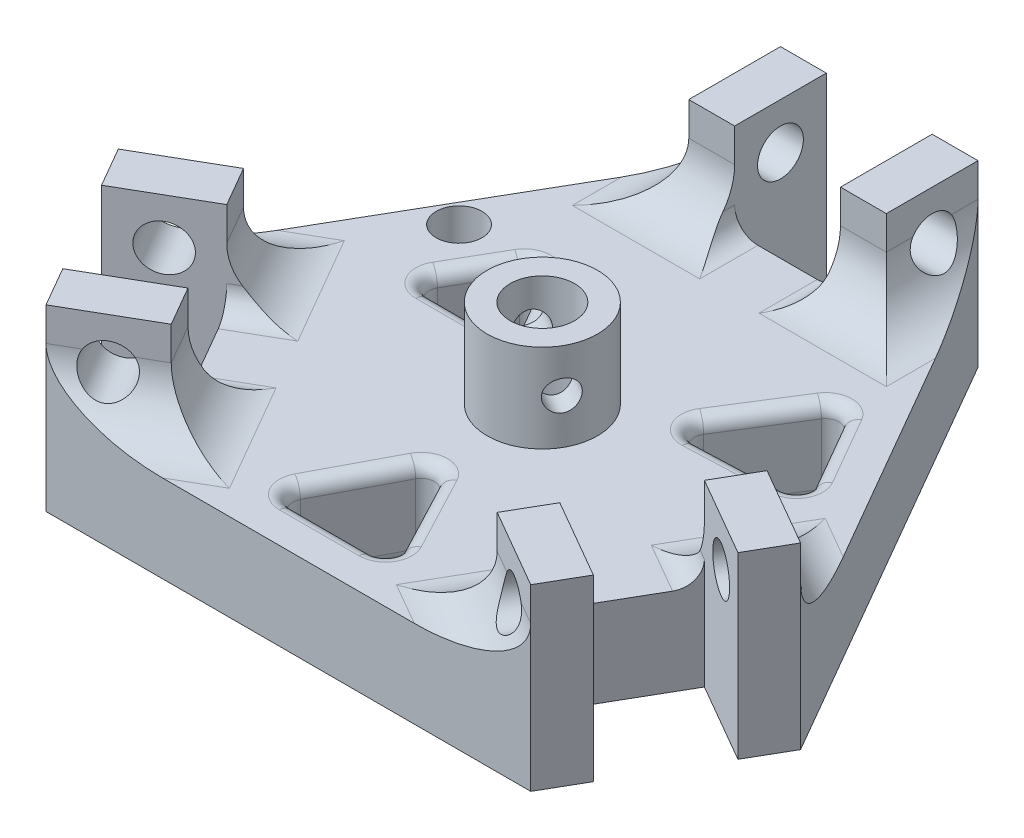
from build123d import *
from OCP.BRepAlgoAPI import BRepAlgoAPI_Cut
from OCP.TopTools import TopTools_ListOfShape

# Parameters (mm, degrees)
BOSS_EXTRUDE1_DEPTH = 19.05
SKETCH2_W           = 10
SKETCH2_H           = 20.000000000000014
SKETCH2_H_2         = 20
BOSS_EXTRUDE2_DEPTH = 20
SKETCH3_R           = 5.0000000000000036
CUT_EXTRUDE1_DEPTH  = 139.28036113669583
SKETCH4_R           = 4.999999999999997
CUT_EXTRUDE2_DEPTH  = 123.5366696211343
SKETCH5_R           = 4.999999999999997
CUT_EXTRUDE3_DEPTH  = 130.8302360256937
CUT_EXTRUDE4_DEPTH  = 120.68795542763824
FILLET1_R           = 12.7
FILLET2_R           = 5.079999999999999
SCALE1_SCALE        = 0.66
SKETCH7_R           = 4.6354999999999995
CUT_EXTRUDE5_DEPTH  = 84.79283151601535
BOSS_EXTRUDE3_START = 12.700000000000001
SKETCH8_R           = 7.949670541950213
SKETCH8_R_2         = 4.635500000000001
BOSS_EXTRUDE3_DEPTH = 12.700000000000001
SKETCH9_R           = 2.1590000000000047
CUT_EXTRUDE6_DEPTH  = 112.34018394089706
SKETCH10_R          = 3.301999999999999
CUT_EXTRUDE8_DEPTH  = 84.79283151601535
CUT_EXTRUDE9_DEPTH  = 84.79283151601535
FILLET3_R           = 1.9049999999999998


with BuildPart() as part:
    # Sketch1 → Boss-Extrude1 (new body)
    with BuildSketch(Plane(origin=(0, 0, 0), x_dir=(1, 0, 0), z_dir=(0, 1, 0))):
        Polygon((-74.42044969854275, 3.47e-15), (-52.87344431475024, -37.320508075688764), (52.87344431475023, -37.320508075688764), (74.42044969854274, 1.995e-14), (21.547005383792506, 91.57949192431124), (-21.547005383792513, 91.57949192431123), align=None)
    extrude(amount=BOSS_EXTRUDE1_DEPTH)

    # Sketch2 → Boss-Extrude2 (add)
    with BuildSketch(Plane(origin=(0, 19.05, 0), x_dir=(1, 0, 0), z_dir=(0, 1, 0))):
        Polygon((52.09994162285397, 1.3397459621556316), (57.09994162285396, 10.00000000000002), (74.42044969854274, 1.995e-14), (69.42044969854274, -8.660254037844359), align=None)
        with Locations((16.547005383792506, 81.57949192431124)):
            Rectangle(SKETCH2_W, SKETCH2_H)
        with Locations((-16.547005383792513, 81.57949192431123)):
            Rectangle(SKETCH2_W, SKETCH2_H_2)
        Polygon((52.87344431475023, -37.320508075688764), (35.55293623906147, -27.320508075688775), (40.55293623906146, -18.660254037844382), (57.87344431475022, -28.66025403784437), align=None)
        Polygon((-52.87344431475024, -37.320508075688764), (-57.87344431475025, -28.660254037844382), (-40.552936239061474, -18.660254037844382), (-35.55293623906148, -27.32050807568877), align=None)
        Polygon((-69.42044969854274, -8.660254037844384), (-74.42044969854275, 3.47e-15), (-57.099941622853976, 9.999999999999998), (-52.09994162285398, 1.3397459621556103), align=None)
    extrude(amount=BOSS_EXTRUDE2_DEPTH)

    # Sketch3 → Cut-Extrude1 (cut, through all)
    with BuildSketch(Plane.ZY.offset(21.547005383792513)):
        with Locations((-81.57949192431123, 29.05)):
            Circle(SKETCH3_R)
    extrude(amount=-CUT_EXTRUDE1_DEPTH, mode=Mode.SUBTRACT)

    # Sketch4 → Cut-Extrude2 (cut, through all)
    with BuildSketch(Plane(origin=(-18.60511242463568, 0, -32.224999999999994), x_dir=(-0.8660254037844386, 0, 0.5000000000000002), z_dir=(-0.5000000000000001, 0, -0.8660254037844385))):
        with Locations((54.449999999999996, 29.05)):
            Circle(SKETCH4_R)
    extrude(amount=-CUT_EXTRUDE2_DEPTH, mode=Mode.SUBTRACT)

    # Sketch5 → Cut-Extrude3 (cut, through all)
    with BuildSketch(Plane(origin=(-2.941892959156835, 0, 5.095508075688795), x_dir=(0.8660254037844387, 0, 0.49999999999999983), z_dir=(-0.49999999999999983, 0, 0.8660254037844387))):
        with Locations((54.44999999999999, 29.05)):
            Circle(SKETCH5_R)
    extrude(amount=-CUT_EXTRUDE3_DEPTH, mode=Mode.SUBTRACT)

    # Sketch6 → Cut-Extrude4 (cut, through all)
    with BuildSketch(Plane(origin=(0, 19.05, 0), x_dir=(1, 0, 0), z_dir=(0, 1, 0))):
        Polygon((-69.42044969854274, -8.660254037844384), (-52.09994162285399, 1.339745962155612), (-40.552936239061474, -18.660254037844382), (-57.87344431475025, -28.660254037844354), align=None)
        Polygon((-11.547005383792513, 71.57949192431123), (11.547005383792506, 71.57949192431123), (11.547005383792506, 91.57949192431124), (-11.547005383792513, 91.57949192431123), align=None)
        Polygon((52.09994162285396, 1.3397459621556327), (69.42044969854274, -8.660254037844359), (57.87344431475022, -28.66025403784437), (40.55293623906146, -18.660254037844382), align=None)
    extrude(amount=-CUT_EXTRUDE4_DEPTH, mode=Mode.SUBTRACT)

    # Fillet1
    # the kernel refuses this fillet: 12.7 mm, written as the material it adds along each edge
    with BuildSketch(Plane(origin=(21.547005383792506, 19.05, -123.32949192431124), x_dir=(1, -2.8e-16, 0), z_dir=(0, 0, 1))) as fillet1_piece_1_section:
        with BuildLine():
            CenterArc((FILLET1_R, FILLET1_R), FILLET1_R, 180, 90)
            Line((-7.11e-15, FILLET1_R), (0, 0))
            Line((0, 0), (FILLET1_R, 0))
        make_face()
    fillet1_piece_1 = extrude(amount=51.750000000000014, mode=Mode.PRIVATE)
    fillet1_piece_1 = split(fillet1_piece_1, bisect_by=Plane(origin=(7.7988520987145495, 19.05, -115.39199192431126), z_dir=(-0.8660254037844388, 0, 0.4999999999999999)), keep=Keep.TOP, mode=Mode.PRIVATE)
    fillet1_piece_1 = fillet1_piece_1 - Plane(origin=(21.547005383792506, 29.05, -81.57949192431123), x_dir=(0, 0, 1), z_dir=(-1, 0, 0)) * Cylinder(5.0000000000000036, 155, mode=Mode.PRIVATE)
    add(fillet1_piece_1)
    with BuildSketch(Plane(origin=(21.547005383792506, 19.05, -71.57949192431123), x_dir=(0, -2.8e-16, 1), z_dir=(-1, 0, 0)), Plane(origin=(-11.547005383792513, 19.05, -71.57949192431123), x_dir=(0, -2.8e-16, 1), z_dir=(-1, 0, 0))) as fillet1_piece_2:
        with BuildLine():
            CenterArc((FILLET1_R, FILLET1_R), FILLET1_R, 180, 90)
            Line((-3.55e-15, FILLET1_R), (0, 0))
            Line((0, 0), (FILLET1_R, 0))
        make_face()
    extrude(amount=10)
    with BuildSketch(Plane(origin=(53.29700538379251, 19.05, -71.57949192431123), x_dir=(0, -2.8e-16, 1), z_dir=(-1, 0, 0))) as fillet1_piece_3_section:
        with BuildLine():
            CenterArc((FILLET1_R, FILLET1_R), FILLET1_R, 180, 90)
            Line((-3.55e-15, FILLET1_R), (0, 0))
            Line((0, 0), (FILLET1_R, 0))
        make_face()
    fillet1_piece_3 = extrude(amount=73.50000000000001, mode=Mode.PRIVATE)
    fillet1_piece_3 = split(fillet1_piece_3, bisect_by=Plane(origin=(-11.54700538379251, 19.05, -71.57949192431123), z_dir=(-1, 0, 0)), keep=Keep.TOP, mode=Mode.PRIVATE)
    add(fillet1_piece_3)
    with BuildSketch(Plane(origin=(-21.547005383792513, 19.05, -71.57949192431123), x_dir=(-1, -2.8e-16, 0), z_dir=(0, 0, -1))) as fillet1_piece_4_section:
        with BuildLine():
            CenterArc((FILLET1_R, FILLET1_R), FILLET1_R, 180, 90)
            Line((-7.11e-15, FILLET1_R), (0, 0))
            Line((0, 0), (FILLET1_R, 0))
        make_face()
    fillet1_piece_4 = extrude(amount=51.75, mode=Mode.PRIVATE)
    fillet1_piece_4 = fillet1_piece_4 - Plane(origin=(-21.547005383792513, 29.05, -81.57949192431123), x_dir=(0, 0, 1), z_dir=(-1, 0, 0)) * Cylinder(5.0000000000000036, 155, mode=Mode.PRIVATE)
    fillet1_piece_4 = split(fillet1_piece_4, bisect_by=Plane(origin=(-30.207259421636905, 19.05, -76.57949192431123), z_dir=(0.8660254037844387, 0, 0.5)), keep=Keep.TOP, mode=Mode.PRIVATE)
    add(fillet1_piece_4)
    with BuildSketch(Plane(origin=(20.202994616207494, 19.05, -71.57949192431123), x_dir=(0, -2.8e-16, 1), z_dir=(-1, 0, 0))) as fillet1_piece_5_section:
        with BuildLine():
            CenterArc((FILLET1_R, FILLET1_R), FILLET1_R, 180, 90)
            Line((-3.55e-15, FILLET1_R), (0, 0))
            Line((0, 0), (FILLET1_R, 0))
        make_face()
    fillet1_piece_5 = extrude(amount=73.50000000000001, mode=Mode.PRIVATE)
    fillet1_piece_5 = split(fillet1_piece_5, bisect_by=Plane(origin=(11.547005383792506, 19.05, -71.57949192431123), z_dir=(1, 0, 0)), keep=Keep.TOP, mode=Mode.PRIVATE)
    add(fillet1_piece_5)
    with BuildSketch(Plane(origin=(57.09994162285396, 19.05, -10.00000000000002), x_dir=(0.49999999999999983, 0, -0.8660254037844387), z_dir=(0.8660254037844387, 0, 0.4999999999999999))) as fillet1_piece_6_section:
        with BuildLine():
            CenterArc((FILLET1_R, FILLET1_R), FILLET1_R, 180, 90)
            Line((-5.09e-15, FILLET1_R), (0, 0))
            Line((0, 0), (FILLET1_R, 0))
        make_face()
    fillet1_piece_6 = extrude(amount=51.75, mode=Mode.PRIVATE)
    fillet1_piece_6 = fillet1_piece_6 - Plane(origin=(65.76019566069837, 29.05, -5.000000000000012), x_dir=(0.8660254037844387, 0, 0.49999999999999983), z_dir=(-0.49999999999999983, 0, 0.8660254037844387)) * Cylinder(4.999999999999997, 155, mode=Mode.PRIVATE)
    fillet1_piece_6 = split(fillet1_piece_6, bisect_by=Plane(origin=(65.76019566069836, 19.05, -15.000000000000023), z_dir=(-0.8660254037844388, 0, 0.4999999999999999)), keep=Keep.TOP, mode=Mode.PRIVATE)
    add(fillet1_piece_6)
    with BuildSketch(Plane(origin=(36.22494162285399, 19.05, 26.156560608000298), x_dir=(-0.866025403784439, 0, -0.49999999999999944), z_dir=(0.49999999999999944, 0, -0.866025403784439))) as fillet1_piece_7_section:
        with BuildLine():
            CenterArc((FILLET1_R, FILLET1_R), FILLET1_R, 180, 90)
            Line((-3.55e-15, FILLET1_R), (0, 0))
            Line((0, 0), (FILLET1_R, 0))
        make_face()
    fillet1_piece_7 = extrude(amount=73.49999999999997, mode=Mode.PRIVATE)
    fillet1_piece_7 = split(fillet1_piece_7, bisect_by=Plane(origin=(40.55293623906147, 19.05, 18.660254037844382), z_dir=(-0.49999999999999983, 0, 0.8660254037844388)), keep=Keep.TOP, mode=Mode.PRIVATE)
    add(fillet1_piece_7)
    with BuildSketch(Plane(origin=(52.09994162285397, 19.05, -1.3397459621556314), x_dir=(-0.866025403784439, 0, -0.49999999999999944), z_dir=(0.49999999999999944, 0, -0.866025403784439))) as fillet1_piece_8:
        with BuildLine():
            CenterArc((FILLET1_R, FILLET1_R), FILLET1_R, 180, 90)
            Line((-4.44e-15, FILLET1_R), (0, 0))
            Line((0, 0), (FILLET1_R, 0))
        make_face()
    extrude(amount=9.999999999999998)
    with BuildSketch(Plane(origin=(35.55293623906147, 19.05, 27.320508075688775), x_dir=(-0.8660254037844392, 0, -0.4999999999999992), z_dir=(0.4999999999999992, 0, -0.8660254037844392))) as fillet1_piece_9:
        with BuildLine():
            CenterArc((FILLET1_R, FILLET1_R), FILLET1_R, 180, 90)
            Line((-1.78e-15, FILLET1_R), (0, 0))
            Line((0, 0), (FILLET1_R, 0))
        make_face()
    extrude(amount=10.000000000000002)
    with BuildSketch(Plane(origin=(19.677936239061488, 19.05, 54.81681464584472), x_dir=(-0.8660254037844392, 0, -0.4999999999999992), z_dir=(0.4999999999999992, 0, -0.8660254037844392))) as fillet1_piece_10_section:
        with BuildLine():
            CenterArc((FILLET1_R, FILLET1_R), FILLET1_R, 180, 90)
            Line((0, FILLET1_R), (0, 0))
            Line((0, 0), (FILLET1_R, 0))
        make_face()
    fillet1_piece_10 = extrude(amount=73.50000000000003, mode=Mode.PRIVATE)
    fillet1_piece_10 = split(fillet1_piece_10, bisect_by=Plane(origin=(52.09994162285398, 19.05, -1.3397459621556251), z_dir=(0.49999999999999956, 0, -0.8660254037844389)), keep=Keep.TOP, mode=Mode.PRIVATE)
    add(fillet1_piece_10)
    with BuildSketch(Plane(origin=(80.36975088490617, 19.05, 53.195508075688764), x_dir=(-0.4999999999999998, 0, 0.8660254037844387), z_dir=(-0.8660254037844388, 0, -0.49999999999999983))) as fillet1_piece_11_section:
        with BuildLine():
            CenterArc((FILLET1_R, FILLET1_R), FILLET1_R, 180, 90)
            Line((-2.6e-15, FILLET1_R), (0, 0))
            Line((0, 0), (FILLET1_R, 0))
        make_face()
    fillet1_piece_11 = extrude(amount=51.75, mode=Mode.PRIVATE)
    fillet1_piece_11 = split(fillet1_piece_11, bisect_by=Plane(origin=(80.36975088490617, 19.05, 37.320508075688764), z_dir=(0, 0, -1)), keep=Keep.TOP, mode=Mode.PRIVATE)
    fillet1_piece_11 = fillet1_piece_11 - Plane(origin=(44.213190276905856, 29.05, 32.32050807568877), x_dir=(0.8660254037844387, 0, 0.49999999999999983), z_dir=(-0.49999999999999983, 0, 0.8660254037844387)) * Cylinder(4.999999999999997, 155, mode=Mode.PRIVATE)
    add(fillet1_piece_11)
    with BuildSketch(Plane(origin=(-35.55293623906148, 19.05, 27.32050807568877), x_dir=(0.5000000000000001, 0, 0.8660254037844386), z_dir=(-0.8660254037844386, 0, 0.5000000000000001))) as fillet1_piece_12_section:
        with BuildLine():
            CenterArc((FILLET1_R, FILLET1_R), FILLET1_R, 180, 90)
            Line((-7.11e-15, FILLET1_R), (0, 0))
            Line((0, 0), (FILLET1_R, 0))
        make_face()
    fillet1_piece_12 = extrude(amount=51.74999999999997, mode=Mode.PRIVATE)
    fillet1_piece_12 = fillet1_piece_12 - Plane(origin=(-44.21319027690585, 29.05, 32.320508075688764), x_dir=(-0.8660254037844386, 0, 0.5000000000000002), z_dir=(-0.5000000000000002, 0, -0.8660254037844386)) * Cylinder(4.999999999999997, 155, mode=Mode.PRIVATE)
    fillet1_piece_12 = split(fillet1_piece_12, bisect_by=Plane(origin=(-35.55293623906148, 19.05, 37.320508075688764), z_dir=(0, 0, -1)), keep=Keep.TOP, mode=Mode.PRIVATE)
    add(fillet1_piece_12)
    with BuildSketch(Plane(origin=(-56.42793623906145, 19.05, -8.836052532311559), x_dir=(0.866025403784439, 0, -0.4999999999999993), z_dir=(0.4999999999999994, 0, 0.866025403784439))) as fillet1_piece_13_section:
        with BuildLine():
            CenterArc((FILLET1_R, FILLET1_R), FILLET1_R, 180, 90)
            Line((-5.33e-15, FILLET1_R), (0, 0))
            Line((0, 0), (FILLET1_R, 0))
        make_face()
    fillet1_piece_13 = extrude(amount=73.50000000000001, mode=Mode.PRIVATE)
    fillet1_piece_13 = split(fillet1_piece_13, bisect_by=Plane(origin=(-52.09994162285396, 19.05, -1.3397459621556305), z_dir=(-0.5000000000000004, 0, -0.8660254037844385)), keep=Keep.TOP, mode=Mode.PRIVATE)
    add(fillet1_piece_13)
    with BuildSketch(Plane(origin=(-40.552936239061474, 19.05, 18.660254037844382), x_dir=(0.866025403784439, 0, -0.4999999999999993), z_dir=(0.4999999999999994, 0, 0.866025403784439))) as fillet1_piece_14:
        with BuildLine():
            CenterArc((FILLET1_R, FILLET1_R), FILLET1_R, 180, 90)
            Line((-5.33e-15, FILLET1_R), (0, 0))
            Line((0, 0), (FILLET1_R, 0))
        make_face()
    extrude(amount=9.999999999999998)
    with BuildSketch(Plane(origin=(-57.099941622853976, 19.05, -9.999999999999998), x_dir=(-6e-17, 1, 3e-17), z_dir=(0.49999999999999944, 0, 0.866025403784439))) as fillet1_piece_15:
        with BuildLine():
            CenterArc((FILLET1_R, -FILLET1_R), FILLET1_R, 90, 90)
            Line((-4.44e-15, -FILLET1_R), (0, 0))
            Line((0, 0), (FILLET1_R, 0))
        make_face()
    extrude(amount=9.999999999999998)
    with BuildSketch(Plane(origin=(-72.97494162285396, 19.05, -37.49630657015594), x_dir=(0, 1, 0), z_dir=(0.49999999999999944, 0, 0.866025403784439))) as fillet1_piece_16_section:
        with BuildLine():
            CenterArc((FILLET1_R, -FILLET1_R), FILLET1_R, 90, 90)
            Line((-3.55e-15, -FILLET1_R), (0, 0))
            Line((0, 0), (FILLET1_R, 0))
        make_face()
    fillet1_piece_16 = extrude(amount=73.5, mode=Mode.PRIVATE)
    fillet1_piece_16 = split(fillet1_piece_16, bisect_by=Plane(origin=(-40.55293623906153, 19.05, 18.66025403784441), z_dir=(0.49999999999999883, 0, 0.8660254037844394)), keep=Keep.TOP, mode=Mode.PRIVATE)
    add(fillet1_piece_16)
    with BuildSketch(Plane(origin=(-101.91675626869869, 19.05, 15.87499999999999), x_dir=(-0.4999999999999997, 0, -0.8660254037844389), z_dir=(0.8660254037844389, 0, -0.4999999999999997))) as fillet1_piece_17_section:
        with BuildLine():
            CenterArc((FILLET1_R, FILLET1_R), FILLET1_R, 180, 90)
            Line((-3.55e-15, FILLET1_R), (0, 0))
            Line((0, 0), (FILLET1_R, 0))
        make_face()
    fillet1_piece_17 = extrude(amount=51.750000000000014, mode=Mode.PRIVATE)
    fillet1_piece_17 = fillet1_piece_17 - Plane(origin=(-65.76019566069837, 29.05, -5.000000000000021), x_dir=(-0.8660254037844386, 0, 0.5000000000000002), z_dir=(-0.5000000000000002, 0, -0.8660254037844386)) * Cylinder(4.999999999999997, 155, mode=Mode.PRIVATE)
    fillet1_piece_17 = split(fillet1_piece_17, bisect_by=Plane(origin=(-88.16860298362072, 19.05, 23.812499999999996), z_dir=(0.8660254037844387, 0, 0.5)), keep=Keep.TOP, mode=Mode.PRIVATE)
    add(fillet1_piece_17)
    with BuildSketch(Plane(origin=(53.29700538379251, 19.05, -71.57949192431123), x_dir=(0, -2.8e-16, 1), z_dir=(-1, 0, 0))) as fillet1_piece_18a_section:
        with BuildLine():
            CenterArc((FILLET1_R, FILLET1_R), FILLET1_R, 180, 90)
            Line((-3.55e-15, FILLET1_R), (0, 0))
            Line((0, 0), (FILLET1_R, 0))
        make_face()
    fillet1_piece_18a = extrude(amount=41.75, mode=Mode.PRIVATE)
    fillet1_piece_18a = split(fillet1_piece_18a, bisect_by=Plane(origin=(38.14475942163689, 19.05, -62.831338639233266), z_dir=(-0.8660254037844388, 0, 0.4999999999999999)), keep=Keep.TOP, mode=Mode.PRIVATE)
    fillet1_piece_18a = split(fillet1_piece_18a, bisect_by=Plane(origin=(21.547005383792506, 19.05, -71.57949192431123), z_dir=(1, 0, 0)), keep=Keep.TOP, mode=Mode.PRIVATE)
    with BuildSketch(Plane(origin=(21.547005383792506, 19.05, -91.57949192431124), x_dir=(1, -2.8e-16, 0), z_dir=(0, 0, 1))) as fillet1_piece_18b_section:
        with BuildLine():
            CenterArc((FILLET1_R, FILLET1_R), FILLET1_R, 180, 90)
            Line((-7.11e-15, FILLET1_R), (0, 0))
            Line((0, 0), (FILLET1_R, 0))
        make_face()
    fillet1_piece_18b = extrude(amount=51.75000000000001, mode=Mode.PRIVATE)
    fillet1_piece_18b = split(fillet1_piece_18b, bisect_by=Plane(origin=(21.547005383792506, 19.05, -71.57949192431123), z_dir=(0, 0, 1)), keep=Keep.TOP, mode=Mode.PRIVATE)
    fillet1_piece_18 = fillet1_piece_18a & fillet1_piece_18b
    add(fillet1_piece_18)
    with BuildSketch(Plane(origin=(-21.547005383792513, 19.05, -39.82949192431123), x_dir=(-1, -2.8e-16, 0), z_dir=(0, 0, -1))) as fillet1_piece_19a_section:
        with BuildLine():
            CenterArc((FILLET1_R, FILLET1_R), FILLET1_R, 180, 90)
            Line((-7.11e-15, FILLET1_R), (0, 0))
            Line((0, 0), (FILLET1_R, 0))
        make_face()
    fillet1_piece_19a = extrude(amount=51.75, mode=Mode.PRIVATE)
    fillet1_piece_19a = split(fillet1_piece_19a, bisect_by=Plane(origin=(-21.547005383792513, 19.05, -71.57949192431123), z_dir=(0, 0, 1)), keep=Keep.TOP, mode=Mode.PRIVATE)
    with BuildSketch(Plane(origin=(-11.547005383792513, 19.05, -71.57949192431123), x_dir=(0, -2.8e-16, 1), z_dir=(-1, 0, 0))) as fillet1_piece_19b_section:
        with BuildLine():
            CenterArc((FILLET1_R, FILLET1_R), FILLET1_R, 180, 90)
            Line((-3.55e-15, FILLET1_R), (0, 0))
            Line((0, 0), (FILLET1_R, 0))
        make_face()
    fillet1_piece_19b = extrude(amount=41.750000000000014, mode=Mode.PRIVATE)
    fillet1_piece_19b = split(fillet1_piece_19b, bisect_by=Plane(origin=(-21.547005383792513, 19.05, -71.57949192431123), z_dir=(-1, 0, 0)), keep=Keep.TOP, mode=Mode.PRIVATE)
    fillet1_piece_19b = split(fillet1_piece_19b, bisect_by=Plane(origin=(-27.7072594216369, 19.05, -80.90961894323343), z_dir=(0.8660254037844387, 0, 0.5)), keep=Keep.TOP, mode=Mode.PRIVATE)
    fillet1_piece_19 = fillet1_piece_19a & fillet1_piece_19b
    add(fillet1_piece_19)
    with BuildSketch(Plane(origin=(29.603635052698024, 19.05, -25.87500000000002), x_dir=(0.4999999999999998, 0, -0.8660254037844387), z_dir=(0.8660254037844387, 0, 0.4999999999999999))) as fillet1_piece_20a_section:
        with BuildLine():
            CenterArc((FILLET1_R, FILLET1_R), FILLET1_R, 180, 90)
            Line((-6.63e-15, FILLET1_R), (0, 0))
            Line((0, 0), (FILLET1_R, 0))
        make_face()
    fillet1_piece_20a = extrude(amount=51.750000000000014, mode=Mode.PRIVATE)
    fillet1_piece_20a = split(fillet1_piece_20a, bisect_by=Plane(origin=(57.099941622853976, 19.05, -10.000000000000032), z_dir=(-0.866025403784439, 0, -0.49999999999999944)), keep=Keep.TOP, mode=Mode.PRIVATE)
    with BuildSketch(Plane(origin=(52.09994162285397, 19.05, -1.3397459621556314), x_dir=(-0.866025403784439, 0, -0.49999999999999944), z_dir=(0.49999999999999944, 0, -0.866025403784439))) as fillet1_piece_20b_section:
        with BuildLine():
            CenterArc((FILLET1_R, FILLET1_R), FILLET1_R, 180, 90)
            Line((-4.44e-15, FILLET1_R), (0, 0))
            Line((0, 0), (FILLET1_R, 0))
        make_face()
    fillet1_piece_20b = extrude(amount=41.749999999999986, mode=Mode.PRIVATE)
    fillet1_piece_20b = split(fillet1_piece_20b, bisect_by=Plane(origin=(57.09994162285397, 19.05, -10.000000000000018), z_dir=(0.4999999999999999, 0, -0.8660254037844387)), keep=Keep.TOP, mode=Mode.PRIVATE)
    fillet1_piece_20b = split(fillet1_piece_20b, bisect_by=Plane(origin=(68.26019566069836, 19.05, -10.669872981077823), z_dir=(-0.8660254037844388, 0, 0.4999999999999999)), keep=Keep.TOP, mode=Mode.PRIVATE)
    fillet1_piece_20 = fillet1_piece_20a & fillet1_piece_20b
    add(fillet1_piece_20)
    with BuildSketch(Plane(origin=(19.677936239061488, 19.05, 54.81681464584472), x_dir=(-0.8660254037844392, 0, -0.4999999999999992), z_dir=(0.4999999999999992, 0, -0.8660254037844392))) as fillet1_piece_21a_section:
        with BuildLine():
            CenterArc((FILLET1_R, FILLET1_R), FILLET1_R, 180, 90)
            Line((0, FILLET1_R), (0, 0))
            Line((0, 0), (FILLET1_R, 0))
        make_face()
    fillet1_piece_21a = extrude(amount=41.750000000000014, mode=Mode.PRIVATE)
    fillet1_piece_21a = split(fillet1_piece_21a, bisect_by=Plane(origin=(19.677936239061488, 19.05, 37.320508075688764), z_dir=(0, 0, -1)), keep=Keep.TOP, mode=Mode.PRIVATE)
    fillet1_piece_21a = split(fillet1_piece_21a, bisect_by=Plane(origin=(35.55293623906149, 19.05, 27.32050807568878), z_dir=(-0.49999999999999983, 0, 0.8660254037844388)), keep=Keep.TOP, mode=Mode.PRIVATE)
    with BuildSketch(Plane(origin=(52.87344431475023, 19.05, 37.320508075688764), x_dir=(-0.4999999999999998, 0, 0.8660254037844387), z_dir=(-0.8660254037844388, 0, -0.49999999999999983))) as fillet1_piece_21b_section:
        with BuildLine():
            CenterArc((FILLET1_R, FILLET1_R), FILLET1_R, 180, 90)
            Line((-6.15e-15, FILLET1_R), (0, 0))
            Line((0, 0), (FILLET1_R, 0))
        make_face()
    fillet1_piece_21b = extrude(amount=51.749999999999986, mode=Mode.PRIVATE)
    fillet1_piece_21b = split(fillet1_piece_21b, bisect_by=Plane(origin=(35.55293623906146, 19.05, 27.320508075688785), z_dir=(-0.8660254037844392, 0, -0.4999999999999992)), keep=Keep.TOP, mode=Mode.PRIVATE)
    fillet1_piece_21 = fillet1_piece_21a & fillet1_piece_21b
    add(fillet1_piece_21)
    with BuildSketch(Plane(origin=(-8.056629668905558, 19.05, 11.445508075688767), x_dir=(0.5000000000000001, 0, 0.8660254037844386), z_dir=(-0.8660254037844386, 0, 0.5000000000000001))) as fillet1_piece_22a_section:
        with BuildLine():
            CenterArc((FILLET1_R, FILLET1_R), FILLET1_R, 180, 90)
            Line((-7.11e-15, FILLET1_R), (0, 0))
            Line((0, 0), (FILLET1_R, 0))
        make_face()
    fillet1_piece_22a = extrude(amount=51.749999999999986, mode=Mode.PRIVATE)
    fillet1_piece_22a = split(fillet1_piece_22a, bisect_by=Plane(origin=(-35.552936239061495, 19.05, 27.32050807568875), z_dir=(0.866025403784439, 0, -0.4999999999999994)), keep=Keep.TOP, mode=Mode.PRIVATE)
    with BuildSketch(Plane(origin=(-40.552936239061474, 19.05, 18.660254037844382), x_dir=(0.866025403784439, 0, -0.4999999999999993), z_dir=(0.4999999999999994, 0, 0.866025403784439))) as fillet1_piece_22b_section:
        with BuildLine():
            CenterArc((FILLET1_R, FILLET1_R), FILLET1_R, 180, 90)
            Line((-5.33e-15, FILLET1_R), (0, 0))
            Line((0, 0), (FILLET1_R, 0))
        make_face()
    fillet1_piece_22b = extrude(amount=41.75000000000001, mode=Mode.PRIVATE)
    fillet1_piece_22b = split(fillet1_piece_22b, bisect_by=Plane(origin=(-35.552936239061474, 19.05, 27.320508075688764), z_dir=(0.5000000000000001, 0, 0.8660254037844386)), keep=Keep.TOP, mode=Mode.PRIVATE)
    fillet1_piece_22b = split(fillet1_piece_22b, bisect_by=Plane(origin=(-40.552936239061474, 19.05, 37.320508075688764), z_dir=(0, 0, -1)), keep=Keep.TOP, mode=Mode.PRIVATE)
    fillet1_piece_22 = fillet1_piece_22a & fillet1_piece_22b
    add(fillet1_piece_22)
    with BuildSketch(Plane(origin=(-72.97494162285396, 19.05, -37.49630657015594), x_dir=(0, 1, 0), z_dir=(0.49999999999999944, 0, 0.866025403784439))) as fillet1_piece_23a_section:
        with BuildLine():
            CenterArc((FILLET1_R, -FILLET1_R), FILLET1_R, 90, 90)
            Line((-3.55e-15, -FILLET1_R), (0, 0))
            Line((0, 0), (FILLET1_R, 0))
        make_face()
    fillet1_piece_23a = extrude(amount=41.75, mode=Mode.PRIVATE)
    fillet1_piece_23a = split(fillet1_piece_23a, bisect_by=Plane(origin=(-57.09994162285397, 19.05, -9.999999999999996), z_dir=(-0.4999999999999997, 0, -0.8660254037844389)), keep=Keep.TOP, mode=Mode.PRIVATE)
    fillet1_piece_23a = split(fillet1_piece_23a, bisect_by=Plane(origin=(-57.822695660698365, 19.05, -28.748153285077983), z_dir=(0.8660254037844387, 0, 0.5)), keep=Keep.TOP, mode=Mode.PRIVATE)
    with BuildSketch(Plane(origin=(-74.42044969854275, 19.05, -3.55e-15), x_dir=(-0.4999999999999997, 0, -0.8660254037844389), z_dir=(0.8660254037844389, 0, -0.4999999999999997))) as fillet1_piece_23b_section:
        with BuildLine():
            CenterArc((FILLET1_R, FILLET1_R), FILLET1_R, 180, 90)
            Line((-4.32e-15, FILLET1_R), (0, 0))
            Line((0, 0), (FILLET1_R, 0))
        make_face()
    fillet1_piece_23b = extrude(amount=51.75000000000002, mode=Mode.PRIVATE)
    fillet1_piece_23b = split(fillet1_piece_23b, bisect_by=Plane(origin=(-57.09994162285397, 19.05, -9.999999999999995), z_dir=(0.866025403784439, 0, -0.49999999999999944)), keep=Keep.TOP, mode=Mode.PRIVATE)
    fillet1_piece_23 = fillet1_piece_23a & fillet1_piece_23b
    add(fillet1_piece_23)

    # Fillet2
    fillet2_edges = [part.edges().sort_by_distance(p)[0] for p in [
        (-46.60068030882147, 19.05, -4.514745962158386),
        (-35.053674925030506, 19.05, 15.485254037842793),
        (-11.547005383793, 19.05, -65.229491924311),
        (11.547005383793, 19.05, -65.229491924311),
        (46.600680308823506, 19.05, -4.514745962157206),
        (35.053674925032404, 19.05, 15.485254037844506),
    ]]
    fillet(fillet2_edges, radius=FILLET2_R)


with BuildPart() as part_1:
    # Scale1: scaled about (2.2e-08, 11.289126018, -18.086330129)
    add(part.part.scale(SCALE1_SCALE).moved(Location((7.48e-09, 3.8383028461199995, -6.149352243859999))))


with BuildPart() as cut_extrude5_tool:
    # Sketch7 → Cut-Extrude5 (new, through all)
    with BuildSketch(Plane(origin=(0, 16.411302175746382, 0), x_dir=(1, 0, 0), z_dir=(0, 1, 0))):
        with Locations(Location((6.89285025671e-06, 18.08631866835895, 0), (0, 0, 270))):
            Circle(SKETCH7_R)
    extrude(amount=-CUT_EXTRUDE5_DEPTH)


with BuildPart() as part_2:
    add(part_1.part)

    # Cut-Extrude5: cut by cut_extrude5_tool, with a tolerance
    cut_extrude5_stock = TopTools_ListOfShape()
    cut_extrude5_stock.Append(part_2.part.wrapped)
    cut_extrude5_tools = TopTools_ListOfShape()
    cut_extrude5_tools.Append(cut_extrude5_tool.part.wrapped)
    cut_extrude5_cut = BRepAlgoAPI_Cut()
    cut_extrude5_cut.SetArguments(cut_extrude5_stock)
    cut_extrude5_cut.SetTools(cut_extrude5_tools)
    cut_extrude5_cut.SetFuzzyValue(0.00001)
    cut_extrude5_cut.Build()
    add(Compound.cast(cut_extrude5_cut.Shape()).solids(), mode=Mode.REPLACE)

    # Sketch8 → Boss-Extrude3 (add)
    with BuildSketch(Plane(origin=(0, 16.411302175746382, 0), x_dir=(1, 0, 0), z_dir=(0, 1, 0)).offset(BOSS_EXTRUDE3_START)):
        with Locations(Location((6.89285025671e-06, 18.08631866835895, 0), (0, 0, 90))):
            Circle(SKETCH8_R)
        with Locations(Location((6.89285025671e-06, 18.08631866835895, 0), (0, 0, 270))):
            Circle(SKETCH8_R_2, mode=Mode.SUBTRACT)
    extrude(amount=-BOSS_EXTRUDE3_DEPTH)

    # Sketch9 → Cut-Extrude6 (cut, through all)
    with BuildSketch(Plane(origin=(22.74384915020002, 0, 13.131167429276195), x_dir=(0.4999999999999999, 0, -0.8660254037844386), z_dir=(0.8660254037844387, 0, 0.49999999999999994))):
        with Locations((15.663214874164735, 22.888302175746386)):
            Circle(SKETCH9_R)
    extrude(amount=-CUT_EXTRUDE6_DEPTH, mode=Mode.SUBTRACT)


with BuildPart() as cut_extrude8_tool:
    # Sketch10 → Cut-Extrude8 (new, through all)
    with BuildSketch(Plane(origin=(0, 16.411302175746382, 0), x_dir=(1, 0, 0), z_dir=(0, 1, 0))):
        with Locations(Location((-28.369696495901636, 34.465574556684736, 0), (0, 0, 270))):
            Circle(SKETCH10_R)
    extrude(amount=-CUT_EXTRUDE8_DEPTH)


with BuildPart() as part_3:
    add(part_2.part)

    # Cut-Extrude8: cut by cut_extrude8_tool, with a tolerance
    cut_extrude8_stock = TopTools_ListOfShape()
    cut_extrude8_stock.Append(part_3.part.wrapped)
    cut_extrude8_tools = TopTools_ListOfShape()
    cut_extrude8_tools.Append(cut_extrude8_tool.part.wrapped)
    cut_extrude8_cut = BRepAlgoAPI_Cut()
    cut_extrude8_cut.SetArguments(cut_extrude8_stock)
    cut_extrude8_cut.SetTools(cut_extrude8_tools)
    cut_extrude8_cut.SetFuzzyValue(0.00001)
    cut_extrude8_cut.Build()
    add(Compound.cast(cut_extrude8_cut.Shape()).solids(), mode=Mode.REPLACE)


with BuildPart() as cut_extrude9_tool:
    # Sketch11 → Cut-Extrude9 (new, through all)
    with BuildSketch(Plane(origin=(0, 16.411302175746382, 0), x_dir=(1, 0, 0), z_dir=(0, 1, 0))):
        Polygon((21.72500575598973, 40.8945403963284), (30.615005755989724, 25.4966087170411), (11.565005755989727, 24.76337387517026), align=None)
        Polygon((-1.65e-15, 4.732208254736418), (8.889999999999997, -12.132193108292553), (-8.889999999999997, -12.132193108292554), align=None)
        Polygon((-17.960582919064212, 37.25468813352216), (-25.580582919064213, 24.056460979847316), (-10.340582919064214, 24.056460979847316), align=None)
    extrude(amount=-CUT_EXTRUDE9_DEPTH)


with BuildPart() as part_4:
    add(part_3.part)

    # Cut-Extrude9: cut by cut_extrude9_tool, with a tolerance
    cut_extrude9_stock = TopTools_ListOfShape()
    cut_extrude9_stock.Append(part_4.part.wrapped)
    cut_extrude9_tools = TopTools_ListOfShape()
    cut_extrude9_tools.Append(cut_extrude9_tool.part.wrapped)
    cut_extrude9_cut = BRepAlgoAPI_Cut()
    cut_extrude9_cut.SetArguments(cut_extrude9_stock)
    cut_extrude9_cut.SetTools(cut_extrude9_tools)
    cut_extrude9_cut.SetFuzzyValue(0.00001)
    cut_extrude9_cut.Build()
    add(Compound.cast(cut_extrude9_cut.Shape()).solids(), mode=Mode.REPLACE)

    # Fillet3
    fillet3_edges = [part_4.edges().sort_by_distance(p)[0] for p in [
        (16.64500575598973, 3.8383028461199977, -32.828957135749334),
        (11.565005755989727, 10.12480251093319, -24.76337387517026),
        (26.170005755989727, 3.8383028461199995, -33.195574556684754),
        (21.72500575598973, 10.12480251093319, -40.8945403963284),
        (21.090005755989722, 3.8383028461199995, -25.12999129610568),
        (30.615005755989724, 10.12480251093319, -25.4966087170411),
        (16.64500575598973, 16.411302175746382, -32.828957135749334),
        (21.090005755989726, 16.411302175746382, -25.12999129610568),
        (26.170005755989727, 16.411302175746382, -33.19557455668475),
        (-4.445, 3.8383028461199995, 3.6999924267780706),
        (-8.889999999999997, 10.12480251093319, 12.132193108292554),
        (4.444999999999998, 3.8383028461199977, 3.699992426778069),
        (-1.65e-15, 10.12480251093319, -4.732208254736418),
        (0, 3.8383028461199995, 12.132193108292554),
        (8.889999999999997, 10.12480251093319, 12.132193108292553),
        (-4.444999999999999, 16.411302175746382, 3.699992426778069),
        (0, 16.411302175746382, 12.132193108292554),
        (4.444999999999998, 16.411302175746382, 3.699992426778068),
        (-14.150582919064213, 3.8383028461199995, -30.65557455668474),
        (-17.960582919064212, 10.12480251093319, -37.25468813352216),
        (-17.960582919064215, 3.8383028461199995, -24.056460979847316),
        (-10.340582919064214, 10.12480251093319, -24.056460979847316),
        (-21.77058291906421, 3.8383028461199995, -30.655574556684737),
        (-25.580582919064213, 10.12480251093319, -24.056460979847316),
        (-14.150582919064213, 16.411302175746382, -30.655574556684737),
        (-21.77058291906421, 16.411302175746382, -30.655574556684737),
        (-17.960582919064215, 16.411302175746382, -24.056460979847316),
    ]]
    fillet(fillet3_edges, radius=FILLET3_R)


solid = part_4.part
